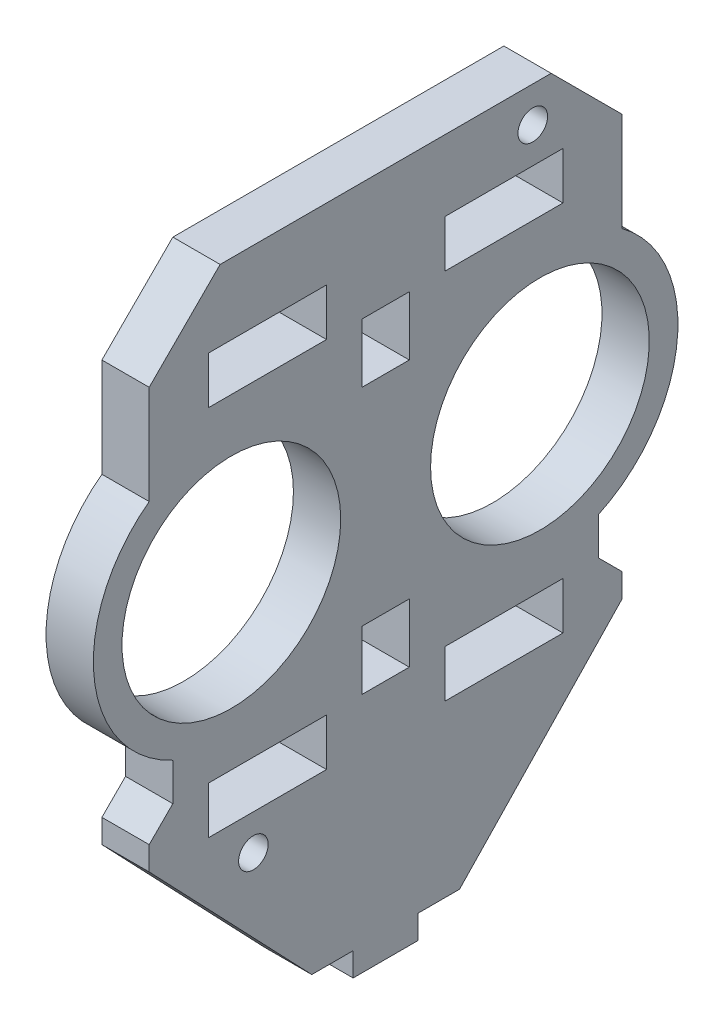
from build123d import *

# Parameters (mm, degrees)
SKETCH1_R           = 2.5
SKETCH1_R_2         = 18.5
BOSS_EXTRUDE1_DEPTH = 8
CUT_EXTRUDE1_REACH  = 86.69
SKETCH2_W           = 20
SKETCH2_H           = 8
SKETCH2_W_2         = 8
SKETCH2_H_2         = 10
SKETCH2_W_3         = 7
SKETCH2_H_3         = 4


with BuildPart() as part:
    # Sketch1 → Boss-Extrude1 (new body)
    with BuildSketch(Plane(origin=(0, 0, 0), x_dir=(0, 0, -1), z_dir=(1, 0, 0))):
        with BuildLine():
            Line((-12.5, -64.29), (-40, -35.5))
            Line((-40, -35.5), (-40, -31.5))
            Line((-40, -31.5), (-36, -27.5))
            Line((-36, -27.5), (-36, -21.143055078))
            ThreePointArc((-36, -21.143055078), (-49.329627244, -2.32877567), (-40, 18.757099403))
            Line((-40, 18.757099403), (-40, 35.5))
            Line((-40, 35.5), (-28, 47.5))
            Line((-28, 47.5), (28, 47.5))
            Line((28, 47.5), (40, 35.5))
            Line((40, 35.5), (40, 18.757099403))
            ThreePointArc((40, 18.757099403), (49.329627244, -2.32877567), (36, -21.143055078))
            Line((36, -21.143055078), (36, -27.5))
            Line((36, -27.5), (40, -31.5))
            Line((40, -31.5), (40, -35.5))
            Line((40, -35.5), (12.5, -64.29))
            Line((12.5, -64.29), (12.5, -68.29))
            Line((12.5, -68.29), (-12.5, -68.29))
            Line((-12.5, -68.29), (-12.5, -64.29))
        make_face()
        with Locations((-22.373880505, -41.5)):
            Circle(SKETCH1_R, mode=Mode.SUBTRACT)
        with Locations((24.891578032, 41.5)):
            Circle(SKETCH1_R, mode=Mode.SUBTRACT)
        with Locations((-26.1, 0)):
            Circle(SKETCH1_R_2, mode=Mode.SUBTRACT)
        with Locations((26.1, 0)):
            Circle(SKETCH1_R_2, mode=Mode.SUBTRACT)
    extrude(amount=BOSS_EXTRUDE1_DEPTH)

    # Sketch2 → Cut-Extrude1 (cut, up to next)
    with BuildSketch(Plane.ZY, mode=Mode.PRIVATE) as cut_extrude1_sk1:
        with Locations((20, -31.5)):
            Rectangle(SKETCH2_W, SKETCH2_H)
    cut_extrude1_tool1 = extrude(cut_extrude1_sk1.sketch, amount=-CUT_EXTRUDE1_REACH, mode=Mode.PRIVATE) & part.part
    # Sketch2 → Cut-Extrude1 (cut, up to next)
    with BuildSketch(Plane.ZY, mode=Mode.PRIVATE) as cut_extrude1_sk2:
        with Locations((-20, -31.5)):
            Rectangle(SKETCH2_W, SKETCH2_H)
    cut_extrude1_tool2 = extrude(cut_extrude1_sk2.sketch, amount=-CUT_EXTRUDE1_REACH, mode=Mode.PRIVATE) & part.part
    # Sketch2 → Cut-Extrude1 (cut, up to next)
    with BuildSketch(Plane.ZY, mode=Mode.PRIVATE) as cut_extrude1_sk3:
        with Locations((20, 31.5)):
            Rectangle(SKETCH2_W, SKETCH2_H)
    cut_extrude1_tool3 = extrude(cut_extrude1_sk3.sketch, amount=-CUT_EXTRUDE1_REACH, mode=Mode.PRIVATE) & part.part
    # Sketch2 → Cut-Extrude1 (cut, up to next)
    with BuildSketch(Plane.ZY, mode=Mode.PRIVATE) as cut_extrude1_sk4:
        with Locations((-20, 31.5)):
            Rectangle(SKETCH2_W, SKETCH2_H)
    cut_extrude1_tool4 = extrude(cut_extrude1_sk4.sketch, amount=-CUT_EXTRUDE1_REACH, mode=Mode.PRIVATE) & part.part
    # Sketch2 → Cut-Extrude1 (cut, up to next)
    with BuildSketch(Plane.ZY, mode=Mode.PRIVATE) as cut_extrude1_sk5:
        with Locations((0, 22.5)):
            Rectangle(SKETCH2_W_2, SKETCH2_H_2)
    cut_extrude1_tool5 = extrude(cut_extrude1_sk5.sketch, amount=-CUT_EXTRUDE1_REACH, mode=Mode.PRIVATE) & part.part
    # Sketch2 → Cut-Extrude1 (cut, up to next)
    with BuildSketch(Plane.ZY, mode=Mode.PRIVATE) as cut_extrude1_sk6:
        with Locations((0, -22.5)):
            Rectangle(SKETCH2_W_2, SKETCH2_H_2)
    cut_extrude1_tool6 = extrude(cut_extrude1_sk6.sketch, amount=-CUT_EXTRUDE1_REACH, mode=Mode.PRIVATE) & part.part
    # Sketch2 → Cut-Extrude1 (cut, up to next)
    with BuildSketch(Plane.ZY, mode=Mode.PRIVATE) as cut_extrude1_sk7:
        with Locations((9, -66.29)):
            Rectangle(SKETCH2_W_3, SKETCH2_H_3)
    cut_extrude1_tool7 = extrude(cut_extrude1_sk7.sketch, amount=-CUT_EXTRUDE1_REACH, mode=Mode.PRIVATE) & part.part
    # Sketch2 → Cut-Extrude1 (cut, up to next)
    with BuildSketch(Plane.ZY, mode=Mode.PRIVATE) as cut_extrude1_sk8:
        with Locations((-9, -66.29)):
            Rectangle(SKETCH2_W_3, SKETCH2_H_3)
    cut_extrude1_tool8 = extrude(cut_extrude1_sk8.sketch, amount=-CUT_EXTRUDE1_REACH, mode=Mode.PRIVATE) & part.part
    add(cut_extrude1_tool1.solids().sort_by_distance((0, -31.5, 20))[0], mode=Mode.SUBTRACT)
    add(cut_extrude1_tool2.solids().sort_by_distance((0, -31.5, -20))[0], mode=Mode.SUBTRACT)
    add(cut_extrude1_tool3.solids().sort_by_distance((0, 31.5, 20))[0], mode=Mode.SUBTRACT)
    add(cut_extrude1_tool4.solids().sort_by_distance((0, 31.5, -20))[0], mode=Mode.SUBTRACT)
    add(cut_extrude1_tool5.solids().sort_by_distance((0, 22.5, 0))[0], mode=Mode.SUBTRACT)
    add(cut_extrude1_tool6.solids().sort_by_distance((0, -22.5, 0))[0], mode=Mode.SUBTRACT)
    add(cut_extrude1_tool7.solids().sort_by_distance((0, -66.29, 9))[0], mode=Mode.SUBTRACT)
    add(cut_extrude1_tool8.solids().sort_by_distance((0, -66.29, -9))[0], mode=Mode.SUBTRACT)


solid = part.part
